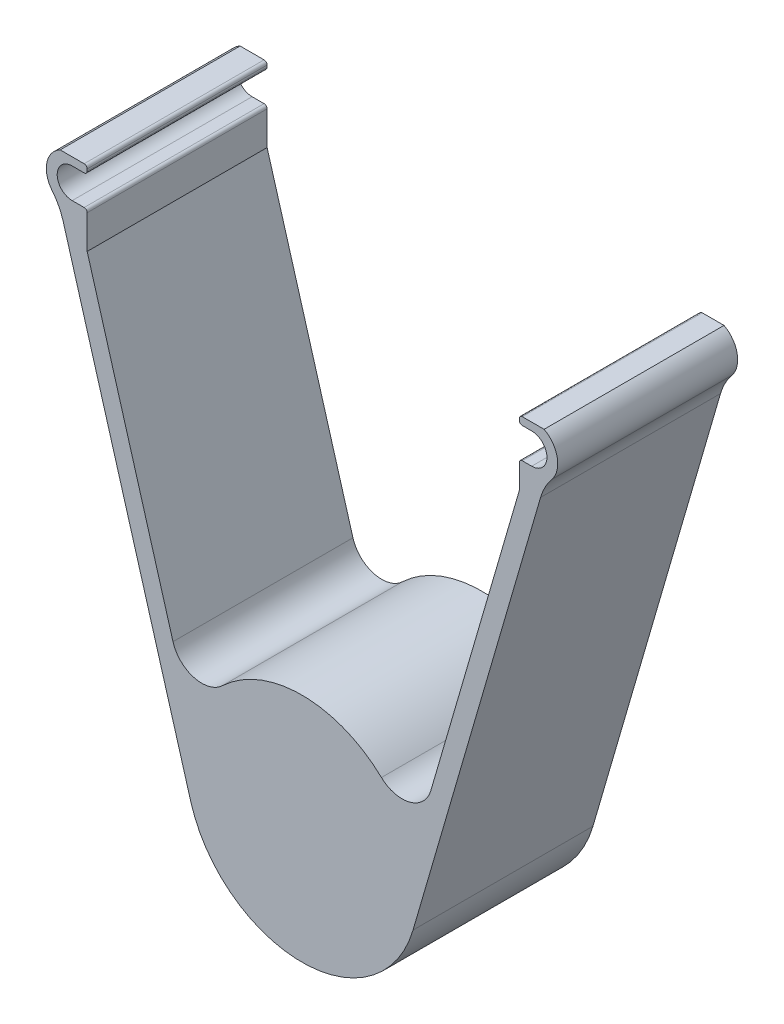
from build123d import *

# Parameters (mm, degrees)
BOSS_EXTRUDE1_DEPTH = 30


with BuildPart() as part:
    # Sketch1 → Boss-Extrude1 (new body)
    with BuildSketch(Plane.XY):
        with BuildLine():
            Line((-21.497040752, 16.247151805), (-35.806960227, 65.4375))
            Line((-35.806960227, 65.4375), (-35.806960227, 71.03125))
            ThreePointArc((-35.806960227, 71.03125), (-35.953406837, 71.384803391), (-36.306960227, 71.53125))
            Line((-36.306960227, 71.53125), (-38.306960227, 71.53125))
            ThreePointArc((-38.306960227, 71.53125), (-40.806960227, 74.03125), (-38.306960227, 76.53125))
            Line((-38.306960227, 76.53125), (-36.306960227, 76.53125))
            ThreePointArc((-36.306960227, 76.53125), (-35.953406837, 76.677696609), (-35.806960227, 77.03125))
            Line((-35.806960227, 77.03125), (-35.806960227, 77.352381128))
            ThreePointArc((-35.806960227, 77.352381128), (-35.953406837, 77.705934519), (-36.306960227, 77.852381128))
            Line((-36.306960227, 77.852381128), (-36.806960227, 77.852381128))
            Line((-36.806960227, 77.852381128), (-39.835272219, 77.852381128))
            Line((-39.835272219, 77.852381128), (-40.306960227, 77.852381128))
            ThreePointArc((-40.306960227, 77.852381128), (-42.531109607, 74.901655147), (-41.654629187, 71.312030326))
            ThreePointArc((-41.654629187, 71.312030326), (-40.558894883, 69.648339101), (-39.81468011, 67.800462879))
            Line((-39.81468011, 67.800462879), (-18.523316062, -5.388601036))
            ThreePointArc((-18.523316062, -5.388601036), (0, -19.291196414), (18.523316062, -5.388601036))
            Line((18.523316062, -5.388601036), (39.789947171, 67.7154434))
            ThreePointArc((39.789947171, 67.7154434), (40.547361928, 69.588425296), (41.665787589, 71.270941964))
            ThreePointArc((41.665787589, 71.270941964), (42.573643308, 74.864691849), (40.379798962, 77.852381128))
            Line((40.379798962, 77.852381128), (39.835272219, 77.852381128))
            Line((39.835272219, 77.852381128), (36.734121492, 77.852381128))
            ThreePointArc((36.734121492, 77.852381128), (36.380568102, 77.705934519), (36.234121492, 77.352381128))
            Line((36.234121492, 77.352381128), (36.234121492, 77.075170354))
            ThreePointArc((36.234121492, 77.075170354), (36.380568102, 76.721616963), (36.734121492, 76.575170354))
            Line((36.734121492, 76.575170354), (38.306960227, 76.575170354))
            ThreePointArc((38.306960227, 76.575170354), (40.851132667, 74.030997914), (38.306960227, 71.486825474))
            Line((38.306960227, 71.486825474), (36.734121492, 71.486825474))
            ThreePointArc((36.734121492, 71.486825474), (36.380568102, 71.340378864), (36.234121492, 70.986825474))
            Line((36.234121492, 70.986825474), (36.234121492, 66.905866849))
            Line((36.234121492, 66.905866849), (21.497040752, 16.247151805))
            ThreePointArc((21.497040752, 16.247151805), (18.005355012, 12.818267647), (13.259415044, 14.012072358))
            ThreePointArc((13.259415044, 14.012072358), (0, 19.291196414), (-13.259415044, 14.012072358))
            ThreePointArc((-13.259415044, 14.012072358), (-18.005355012, 12.818267647), (-21.497040752, 16.247151805))
        make_face()
    extrude(amount=BOSS_EXTRUDE1_DEPTH)


solid = part.part
